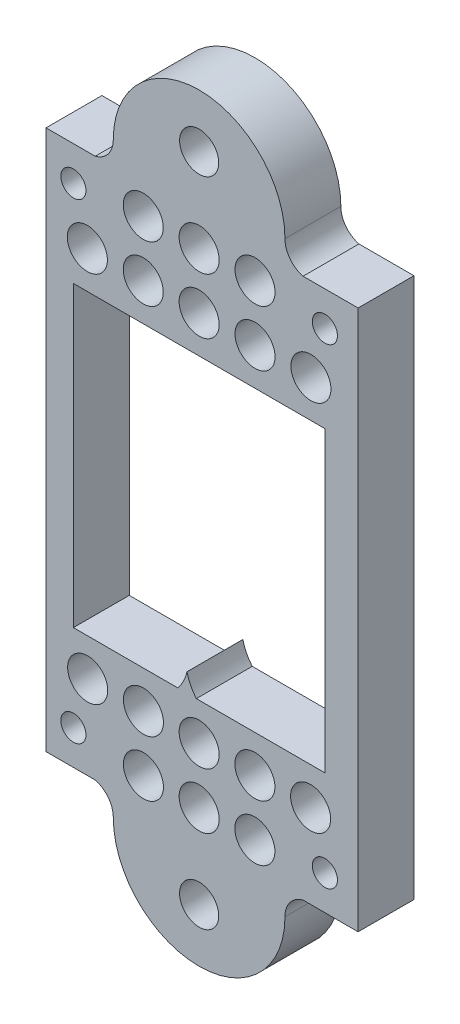
from build123d import *

# Parameters (mm, degrees)
SKETCH1_R           = 1.35
SKETCH1_R_2         = 2.1
BOSS_EXTRUDE1_DEPTH = 6
SKETCH2_R           = 2.15
CUT_EXTRUDE1_DEPTH  = 4.2


with BuildPart() as part:
    # Sketch1 → Boss-Extrude1 (new body)
    with BuildSketch(Plane.XY):
        with BuildLine():
            Line((-16.436457619, 29), (-11.155935204, 29))
            ThreePointArc((-11.155935204, 29), (-9.748616749, 29.926511277), (-9.214880919, 31.524664725))
            ThreePointArc((-9.214880919, 31.524664725), (0, 40.739545643), (9.214880919, 31.524664725))
            ThreePointArc((9.214880919, 31.524664725), (9.748616749, 29.926511277), (11.155935204, 29))
            Line((11.155935204, 29), (17.063542381, 29))
            Line((17.063542381, 29), (17.063542381, -29))
            Line((17.063542381, -29), (11.155935204, -29))
            ThreePointArc((11.155935204, -29), (9.748616749, -29.926511277), (9.214880919, -31.524664725))
            ThreePointArc((9.214880919, -31.524664725), (0, -40.739545643), (-9.214880919, -31.524664725))
            ThreePointArc((-9.214880919, -31.524664725), (-9.748616749, -29.926511277), (-11.155935204, -29))
            Line((-11.155935204, -29), (-16.436457619, -29))
            Line((-16.436457619, -29), (-16.436457619, 29))
        make_face()
        with Locations((-13.5, 25.3)):
            Circle(SKETCH1_R, mode=Mode.SUBTRACT)
        with Locations((13.5, -25.3)):
            Circle(SKETCH1_R, mode=Mode.SUBTRACT)
        with Locations((-13.5, -25.3)):
            Circle(SKETCH1_R, mode=Mode.SUBTRACT)
        with Locations((13.5, 25.3)):
            Circle(SKETCH1_R, mode=Mode.SUBTRACT)
        with Locations((0, 35)):
            Circle(SKETCH1_R_2, mode=Mode.SUBTRACT)
        with Locations((0, -35)):
            Circle(SKETCH1_R_2, mode=Mode.SUBTRACT)
        with BuildLine():
            Line((-13.5, 16), (13.5, 16))
            Line((13.5, 16), (13.5, -16))
            Line((13.5, -16), (-0.3, -16))
            ThreePointArc((-0.3, -16), (-0.921986523, -15.060993262), (-1.3, -14))
            ThreePointArc((-1.3, -14), (-1.678013477, -15.060993262), (-2.3, -16))
            Line((-2.3, -16), (-13.5, -16))
            Line((-13.5, -16), (-13.5, 16))
        make_face(mode=Mode.SUBTRACT)
    extrude(amount=BOSS_EXTRUDE1_DEPTH)

    # Sketch2 → Cut-Extrude1 (cut)
    with BuildSketch(Plane.XY.offset(6)):
        with Locations((-12, 20)):
            Circle(SKETCH2_R)
        with Locations((-6, 20)):
            Circle(SKETCH2_R)
        with Locations((0, 20)):
            Circle(SKETCH2_R)
        with Locations((6, 20)):
            Circle(SKETCH2_R)
        with Locations((12, 20)):
            Circle(SKETCH2_R)
        with Locations((-6, 26)):
            Circle(SKETCH2_R)
        with Locations((0, 26)):
            Circle(SKETCH2_R)
        with Locations((6, 26)):
            Circle(SKETCH2_R)
        with Locations((-11.967349369, -20)):
            Circle(SKETCH2_R)
        with Locations((-5.983674685, -20)):
            Circle(SKETCH2_R)
        with Locations((0, -20)):
            Circle(SKETCH2_R)
        with Locations((5.983674685, -20)):
            Circle(SKETCH2_R)
        with Locations((11.967349369, -20)):
            Circle(SKETCH2_R)
        with Locations((-5.983674685, -26)):
            Circle(SKETCH2_R)
        with Locations((0, -26)):
            Circle(SKETCH2_R)
        with Locations((5.983674685, -26)):
            Circle(SKETCH2_R)
    extrude(amount=-CUT_EXTRUDE1_DEPTH, mode=Mode.SUBTRACT)


solid = part.part
